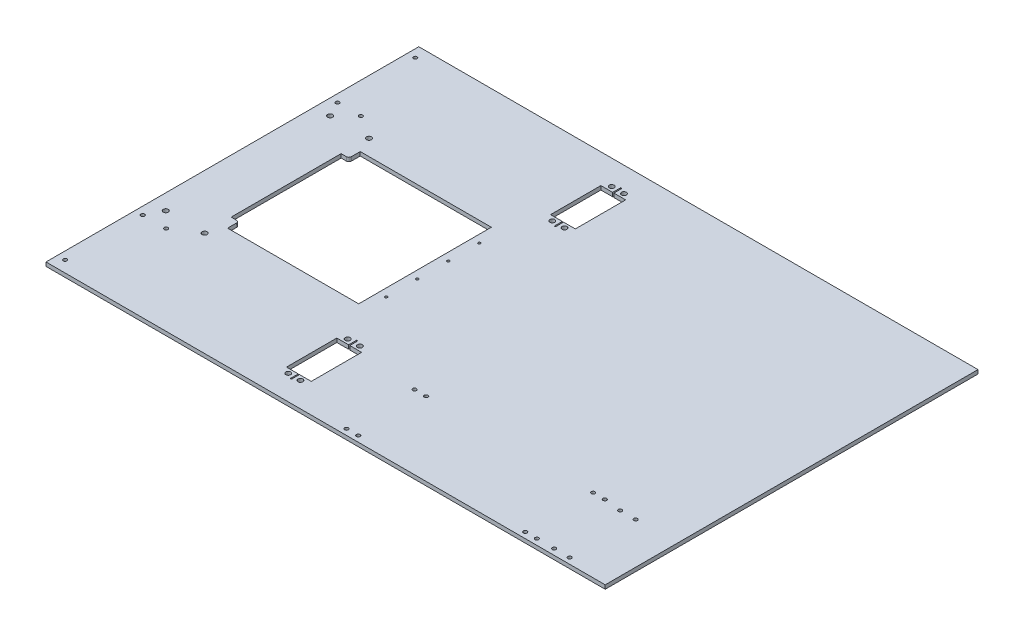
from build123d import *

# Parameters (mm, degrees)
SKETCH1_W           = 457.2
SKETCH1_H           = 304.8
BOSS_EXTRUDE1_DEPTH = 3.175
SKETCH2_R           = 2.063499937
SKETCH2_R_2         = 2.063500064
CUT_EXTRUDE1_DEPTH  = 275.761352131
CUT_EXTRUDE2_REACH  = 276.761
SKETCH5_R           = 1.500000048
CUT_EXTRUDE3_DEPTH  = 275.761352131
SKETCH7_R           = 2.000000064
CUT_EXTRUDE5_DEPTH  = 275.761352131
SKETCH8_R           = 1.000000032
CUT_EXTRUDE6_DEPTH  = 275.761352131
SKETCH12_R          = 1.500000048
CUT_EXTRUDE7_DEPTH  = 275.761352131


with BuildPart() as part:
    # Sketch1 → Boss-Extrude1 (new body)
    with BuildSketch(Plane(origin=(0, 0, 0), x_dir=(1, 0, 0), z_dir=(0, 1, 0))):
        Rectangle(SKETCH1_W, SKETCH1_H)
    extrude(amount=BOSS_EXTRUDE1_DEPTH)

    # Sketch2 → Cut-Extrude1 (cut, through all)
    with BuildSketch(Plane(origin=(0, 3.175, 0), x_dir=(1, 0, 0), z_dir=(0, 1, 0))):
        with Locations((-184.15, -67.197573915)):
            Circle(SKETCH2_R)
        with Locations((-215.9, -67.197573915)):
            Circle(SKETCH2_R_2)
        with Locations((-184.15, 67.197573915)):
            Circle(SKETCH2_R)
        with Locations((-215.9, 67.197573915)):
            Circle(SKETCH2_R_2)
    extrude(amount=-CUT_EXTRUDE1_DEPTH, mode=Mode.SUBTRACT)

    # Sketch4 → Cut-Extrude2 (cut, up to next)
    with BuildSketch(Plane(origin=(0, 3.175, 0), x_dir=(1, 0, 0), z_dir=(0, 1, 0)), mode=Mode.PRIVATE) as cut_extrude2_sk1:
        with BuildLine():
            Line((-184.658, 44.958), (-184.658, -44.958))
            Line((-184.658, -44.958), (-180.34, -44.958))
            ThreePointArc((-180.34, -44.958), (-178.903159021, -45.553159021), (-178.308, -46.99))
            Line((-178.308, -46.99), (-178.308, -54.229))
            Line((-178.308, -54.229), (-71.12, -54.229))
            Line((-71.12, -54.229), (-71.12, 54.229))
            Line((-71.12, 54.229), (-178.308, 54.229))
            Line((-178.308, 54.229), (-178.308, 46.99))
            ThreePointArc((-178.308, 46.99), (-178.903159021, 45.553159021), (-180.34, 44.958))
            Line((-180.34, 44.958), (-184.658, 44.958))
        make_face()
    cut_extrude2_tool1 = extrude(cut_extrude2_sk1.sketch, amount=-CUT_EXTRUDE2_REACH, mode=Mode.PRIVATE) & part.part
    add(cut_extrude2_tool1.solids().sort_by_distance((-127.379078, 3.175, 0))[0], mode=Mode.SUBTRACT)

    # Sketch5 → Cut-Extrude3 (cut, through all)
    with BuildSketch(Plane(origin=(0, 3.175, 0), x_dir=(1, 0, 0), z_dir=(0, 1, 0))):
        with Locations((-203.2, 79.629)):
            Circle(SKETCH5_R)
        with Locations((-222.25, 143.129)):
            Circle(SKETCH5_R)
        with Locations((-222.25, 79.629)):
            Circle(SKETCH5_R)
        with Locations((-203.2, -79.629)):
            Circle(SKETCH5_R)
        with Locations((-222.25, -79.629)):
            Circle(SKETCH5_R)
        with Locations((-222.25, -143.129)):
            Circle(SKETCH5_R)
    extrude(amount=-CUT_EXTRUDE3_DEPTH, mode=Mode.SUBTRACT)

    # Sketch7 → Cut-Extrude5 (cut, through all)
    with BuildSketch(Plane(origin=(0, 3.175, 0), x_dir=(1, 0, 0), z_dir=(0, 1, 0))):
        with Locations((-50.720000033, -132.250000041)):
            Circle(SKETCH7_R)
        with Locations((-40.719999967, -132.250000041)):
            Circle(SKETCH7_R)
        with Locations((-50.720000033, -83.649999959)):
            Circle(SKETCH7_R)
        with Locations((-40.719999967, -83.649999959)):
            Circle(SKETCH7_R)
        Polygon((-55.846999939, -87.373000006), (-46.22, -87.373000006), (-46.22, -80.769000006), (-45.22, -80.769000006), (-45.22, -87.373000006), (-35.593000061, -87.373000006), (-35.593000061, -128.526999994), (-45.22, -128.526999994), (-45.22, -135.130999994), (-46.22, -135.130999994), (-46.22, -128.526999994), (-55.846999939, -128.526999994), align=None)
    cut_extrude5 = extrude(amount=-CUT_EXTRUDE5_DEPTH, mode=Mode.SUBTRACT)

    # Mirror1: Cut-Extrude5 across plane
    add(cut_extrude5.mirror(Plane.XY), mode=Mode.SUBTRACT)

    # Sketch8 → Cut-Extrude6 (cut, through all)
    with BuildSketch(Plane(origin=(0, 3.175, 0), x_dir=(1, 0, 0), z_dir=(0, 1, 0))):
        with Locations((-64.77, -38.1)):
            Circle(SKETCH8_R)
        with Locations((-64.77, -12.7)):
            Circle(SKETCH8_R)
        with Locations((-64.77, 12.7)):
            Circle(SKETCH8_R)
        with Locations((-64.77, 38.1)):
            Circle(SKETCH8_R)
    extrude(amount=-CUT_EXTRUDE6_DEPTH, mode=Mode.SUBTRACT)

    # Sketch12 → Cut-Extrude7 (cut, through all)
    with BuildSketch(Plane(origin=(0, 3.175, 0), x_dir=(1, 0, 0), z_dir=(0, 1, 0))):
        with Locations((194.770000148, -93.6625)):
            Circle(SKETCH12_R)
        with Locations((182.070000148, -93.6625)):
            Circle(SKETCH12_R)
        with Locations((194.770000148, -147.6375)):
            Circle(SKETCH12_R)
        with Locations((182.070000148, -147.6375)):
            Circle(SKETCH12_R)
        with Locations((167.957500148, -92.075)):
            Circle(SKETCH12_R)
        with Locations((158.432500148, -92.075)):
            Circle(SKETCH12_R)
        with Locations((167.957500148, -147.6375)):
            Circle(SKETCH12_R)
        with Locations((158.432500148, -147.6375)):
            Circle(SKETCH12_R)
        with Locations((21.907500148, -147.6375)):
            Circle(SKETCH12_R)
        with Locations((12.382500148, -147.6375)):
            Circle(SKETCH12_R)
        with Locations((12.382500148, -92.075)):
            Circle(SKETCH12_R)
        with Locations((21.907500148, -92.075)):
            Circle(SKETCH12_R)
    extrude(amount=-CUT_EXTRUDE7_DEPTH, mode=Mode.SUBTRACT)


solid = part.part
